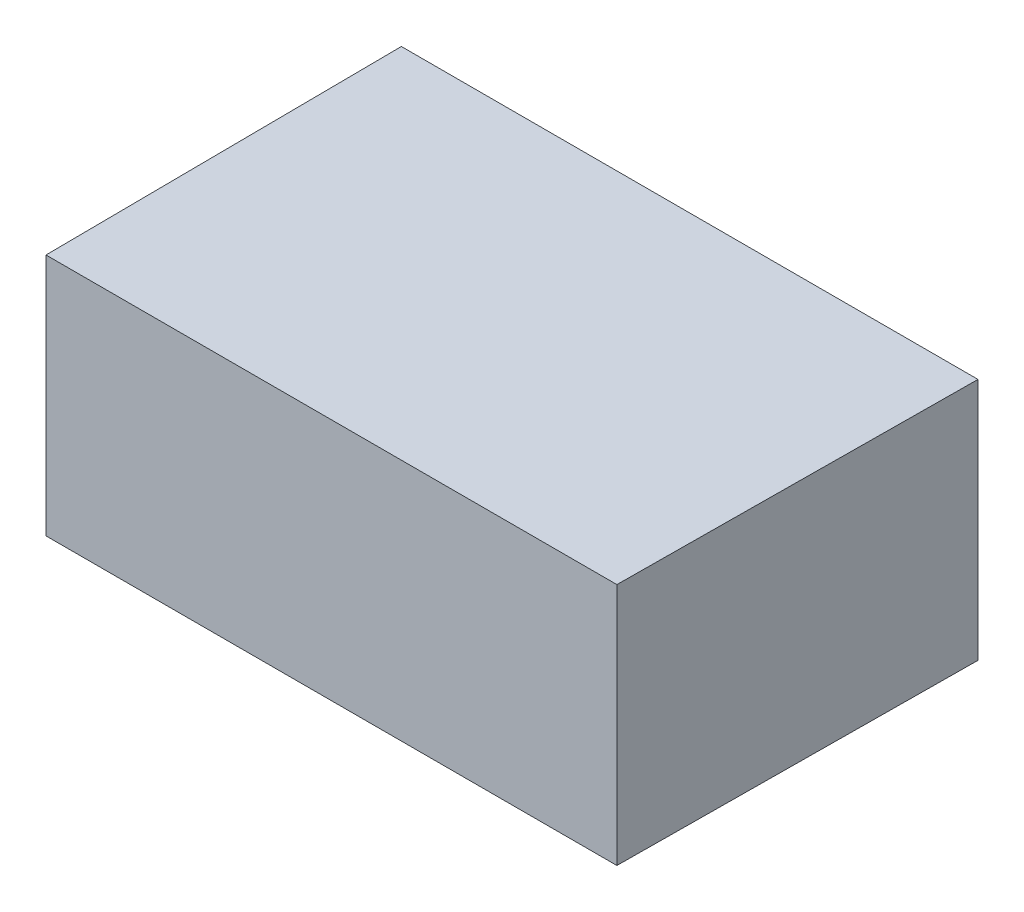
from build123d import *

# Parameters (mm, degrees)
SKETCH_1_W            = 150.5
SKETCH_1_H            = 63.5
EXTRUDE_1_DEPTH       = 93.5
SKETCH_2_W            = 1
SKETCH_2_H            = 7
CUT_EXTRUDE_847_DEPTH = 136.783145125


with BuildPart() as part:
    # 草图1 → 拉伸1 (new body)
    with BuildSketch(Plane.XY):
        Rectangle(SKETCH_1_W, SKETCH_1_H)
    extrude(amount=EXTRUDE_1_DEPTH)

    # 扫描1: sweep along a path in 草图3
    with BuildLine(Plane(origin=(0, 19, 0), x_dir=(-1, 0, 0), z_dir=(0, 1, 0))) as sweep_1_path:
        Line((59.75, 0), (59.75, -4))
        Line((59.75, -4), (48.75, -4))
    # 草图2 → 扫描1 (sweep)
    with BuildSketch(Plane(origin=(0, 0, 0), x_dir=(-1, 0, 0), z_dir=(0, 0, -1))):
        with Locations((59.75, 21.25)):
            Rectangle(SKETCH_2_W, SKETCH_2_H)
    sweep_1 = sweep(path=sweep_1_path.line, transition=Transition.RIGHT)

    # 镜向1: 扫描1 across plane
    add(sweep_1.mirror(Plane.ZX))

    # 草图5 → Cut-Extrude 847 (cut, through all)
    with BuildSketch(Plane.XZ.offset(31.75)):
        Polygon((-75.25, 0), (-74.5, 93.5), (-75.25, 93.5), align=None)
        Polygon((74.5, 93.5), (75.25, 93.5), (75.25, 0), align=None)
    extrude(amount=-CUT_EXTRUDE_847_DEPTH, mode=Mode.SUBTRACT)


solid = part.part
